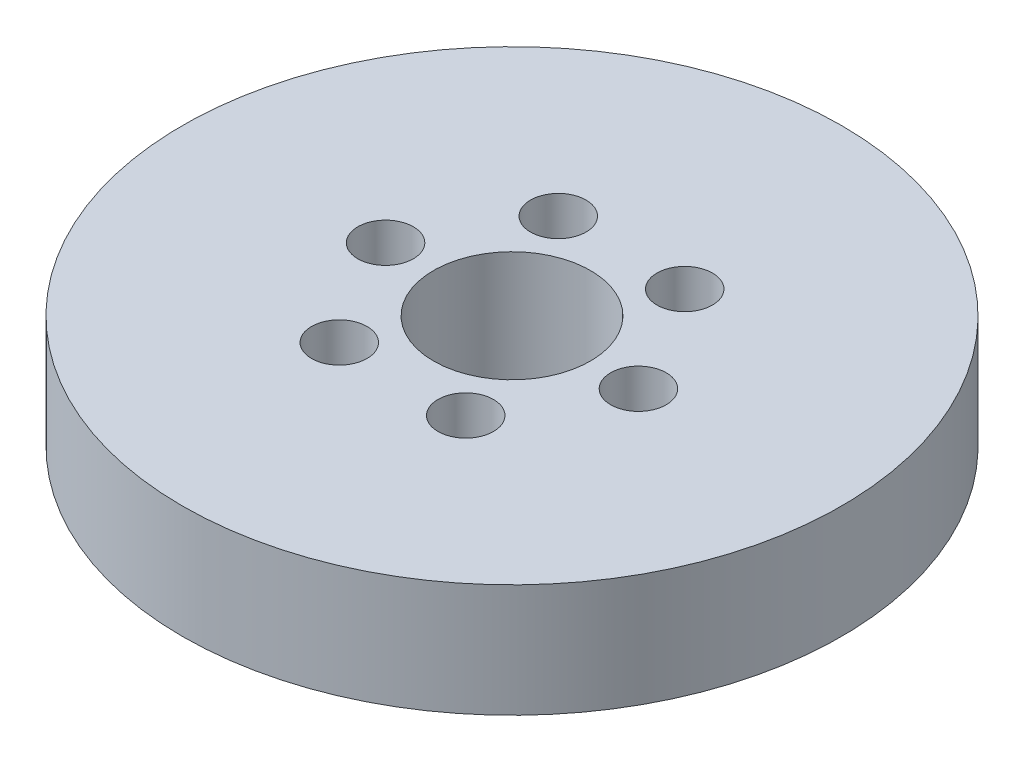
from build123d import *

# Parameters (mm, degrees)
SKETCH1_R           = 52.5
BOSS_EXTRUDE1_DEPTH = 18
SKETCH2_R           = 12.5
CUT_EXTRUDE1_DEPTH  = 77.396989469
SKETCH3_R           = 4.424048946
CUT_EXTRUDE2_DEPTH  = 14.666816431
CIRPATTERN1_COUNT   = 6


with BuildPart() as part:
    # Sketch1 → Boss-Extrude1 (new body)
    with BuildSketch(Plane(origin=(0, 0, 0), x_dir=(1, 0, 0), z_dir=(0, 1, 0))):
        Circle(SKETCH1_R)
    extrude(amount=BOSS_EXTRUDE1_DEPTH)

    # Sketch2 → Cut-Extrude1 (cut, through all)
    with BuildSketch(Plane(origin=(0, 0, 0), x_dir=(1, 0, 0), z_dir=(0, 1, 0))):
        Circle(SKETCH2_R)
    extrude(amount=CUT_EXTRUDE1_DEPTH, mode=Mode.SUBTRACT)

    # Sketch3 → Cut-Extrude2 (cut)
    with BuildSketch(Plane(origin=(0, 18, 0), x_dir=(1, 0, 0), z_dir=(0, 1, 0))):
        with Locations((-20.140893143, 0)):
            Circle(SKETCH3_R)
    cut_extrude2 = extrude(amount=-CUT_EXTRUDE2_DEPTH, mode=Mode.SUBTRACT)

    # CirPattern1: Cut-Extrude2 ×6 about axis
    cirpattern1_axis = Axis((0, 0, 0), (0, 1, 0))
    for i in range(1, CIRPATTERN1_COUNT):
        add(cut_extrude2.rotate(cirpattern1_axis, i * 360 / CIRPATTERN1_COUNT), mode=Mode.SUBTRACT)


solid = part.part
